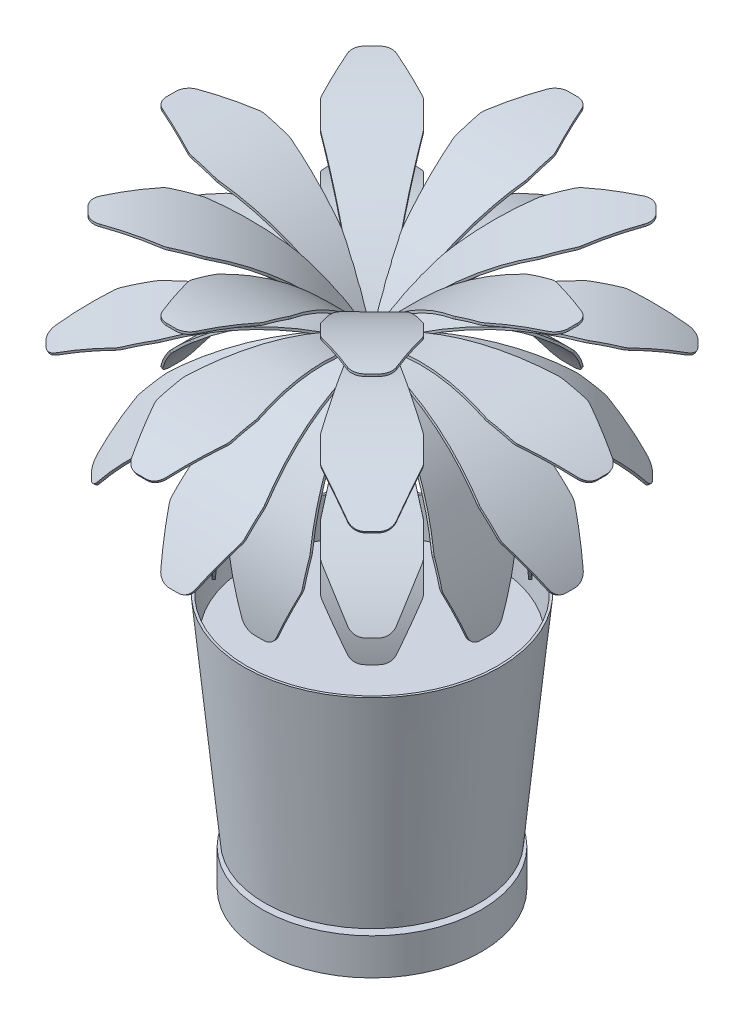
from build123d import *

# Parameters (mm, degrees)
SKETCH3_R           = 9.525
BOSS_EXTRUDE1_DEPTH = 177.8
BOSS_EXTRUDE1_TAPER = 2
BOSS_EXTRUDE2_DEPTH = 25.4
SKETCH5_OUTSIDE_W   = 263.022
SKETCH5_OUTSIDE_H   = 416.765
CUT_EXTRUDE1_DEPTH  = 355.580540036
FILLET6_R           = 9.525
CIRPATTERN2_COUNT   = 4
CIRPATTERN2_ANGLE   = 90
CIRPATTERN3_COUNT   = 8
SCALE2_SCALE        = 0.322033898


with BuildPart() as part:
    # Sketch1 → Revolve1 (revolve)
    with BuildSketch(Plane.XY, mode=Mode.PRIVATE) as revolve1_sk:
        Polygon((0, 0), (0, 152.4), (84.873325365, 152.4), (87.305240259, 177.8), (88.9, 177.8), (74.6125, 28.575), (69.85, 28.575), (69.85, 25.4), (76.2, 25.4), (76.2, 0), align=None)
    revolve(revolve1_sk.sketch.rotate(Axis((0, 0, 0), (0, -1, 0)), 180), axis=Axis((0, 0, 0), (0, -1, 0)))


with BuildPart() as body_2:
    # Sketch3 → Boss-Extrude1 (new body)
    with BuildSketch(Plane(origin=(0, 152.4, 0), x_dir=(1, 0, 0), z_dir=(0, 1, 0))):
        Circle(SKETCH3_R)
    extrude(amount=BOSS_EXTRUDE1_DEPTH, taper=BOSS_EXTRUDE1_TAPER)


with BuildPart() as body_3:
    # Sketch4 → Boss-Extrude2 (new, symmetric)
    with BuildSketch(Plane.XY):
        with BuildLine():
            Line((77.111818976, 190.5), (78.699318976, 190.5))
            ThreePointArc((78.699318976, 190.5), (57.943784129, 271.051748602), (0.846040202, 331.543269231))
            Line((0.846040202, 331.543269231), (0, 330.2))
            ThreePointArc((0, 330.2), (56.553955889, 270.284589091), (77.111818976, 190.5))
        make_face()
    extrude(amount=BOSS_EXTRUDE2_DEPTH, both=True)

    # Sketch5 outside → Cut-Extrude1 (cut, through all)
    with BuildSketch(Plane(origin=(0, 0, 0), x_dir=(0, 0, -1), z_dir=(1, 0, 0))):
        with Locations((0, 165.7715)):
            Rectangle(SKETCH5_OUTSIDE_W, SKETCH5_OUTSIDE_H)
        Polygon((-9.525, 190.5), (-25.4, 228.6), (-25.4, 247.65), (-6.35, 331.543269231), (6.35, 331.543269231), (25.4, 247.65), (25.4, 228.6), (9.525, 190.5), align=None, mode=Mode.SUBTRACT)
    extrude(amount=CUT_EXTRUDE1_DEPTH, mode=Mode.SUBTRACT)

    # Fillet6
    fillet6_edges = [body_3.edges().sort_by_distance(p)[0] for p in [
        (73.471074534, 228.6, 25.4),
        (67.750474889, 247.65, 25.4),
        (67.750474889, 247.65, -25.4),
        (73.471074534, 228.6, -25.4),
        (77.905568976, 190.5, 9.525),
        (77.905568976, 190.5, -9.525),
    ]]
    fillet(fillet6_edges, radius=FILLET6_R)


with BuildPart() as cirpattern2_1:
    # CirPattern2: pattern copy
    add(body_3.part.rotate(Axis((0, 330.2, 0), (0, 0, 1)), 1 * CIRPATTERN2_ANGLE / (CIRPATTERN2_COUNT - 1)))


with BuildPart() as cirpattern2_2:
    # CirPattern2: pattern copy
    add(body_3.part.rotate(Axis((0, 330.2, 0), (0, 0, 1)), 2 * CIRPATTERN2_ANGLE / (CIRPATTERN2_COUNT - 1)))


with BuildPart() as cirpattern2_3:
    # CirPattern2: pattern copy
    add(body_3.part.rotate(Axis((0, 330.2, 0), (0, 0, 1)), 3 * CIRPATTERN2_ANGLE / (CIRPATTERN2_COUNT - 1)))


with BuildPart() as cirpattern3_1:
    # CirPattern3: pattern copy
    add(cirpattern2_3.part.rotate(Axis((0, 0, 0), (0, 1, 0)), 1 * 360 / CIRPATTERN3_COUNT))


with BuildPart() as cirpattern3_2:
    # CirPattern3: pattern copy
    add(cirpattern2_3.part.rotate(Axis((0, 0, 0), (0, 1, 0)), 2 * 360 / CIRPATTERN3_COUNT))


with BuildPart() as cirpattern3_3:
    # CirPattern3: pattern copy
    add(cirpattern2_3.part.rotate(Axis((0, 0, 0), (0, 1, 0)), 3 * 360 / CIRPATTERN3_COUNT))


with BuildPart() as cirpattern3_4:
    # CirPattern3: pattern copy
    add(cirpattern2_3.part.rotate(Axis((0, 0, 0), (0, 1, 0)), 4 * 360 / CIRPATTERN3_COUNT))


with BuildPart() as cirpattern3_5:
    # CirPattern3: pattern copy
    add(cirpattern2_3.part.rotate(Axis((0, 0, 0), (0, 1, 0)), 5 * 360 / CIRPATTERN3_COUNT))


with BuildPart() as cirpattern3_6:
    # CirPattern3: pattern copy
    add(cirpattern2_3.part.rotate(Axis((0, 0, 0), (0, 1, 0)), 6 * 360 / CIRPATTERN3_COUNT))


with BuildPart() as cirpattern3_7:
    # CirPattern3: pattern copy
    add(cirpattern2_3.part.rotate(Axis((0, 0, 0), (0, 1, 0)), 7 * 360 / CIRPATTERN3_COUNT))


with BuildPart() as cirpattern3_8:
    # CirPattern3: pattern copy
    add(cirpattern2_2.part.rotate(Axis((0, 0, 0), (0, 1, 0)), 1 * 360 / CIRPATTERN3_COUNT))


with BuildPart() as cirpattern3_9:
    # CirPattern3: pattern copy
    add(cirpattern2_2.part.rotate(Axis((0, 0, 0), (0, 1, 0)), 2 * 360 / CIRPATTERN3_COUNT))


with BuildPart() as cirpattern3_10:
    # CirPattern3: pattern copy
    add(cirpattern2_2.part.rotate(Axis((0, 0, 0), (0, 1, 0)), 3 * 360 / CIRPATTERN3_COUNT))


with BuildPart() as cirpattern3_11:
    # CirPattern3: pattern copy
    add(cirpattern2_2.part.rotate(Axis((0, 0, 0), (0, 1, 0)), 4 * 360 / CIRPATTERN3_COUNT))


with BuildPart() as cirpattern3_12:
    # CirPattern3: pattern copy
    add(cirpattern2_2.part.rotate(Axis((0, 0, 0), (0, 1, 0)), 5 * 360 / CIRPATTERN3_COUNT))


with BuildPart() as cirpattern3_13:
    # CirPattern3: pattern copy
    add(cirpattern2_2.part.rotate(Axis((0, 0, 0), (0, 1, 0)), 6 * 360 / CIRPATTERN3_COUNT))


with BuildPart() as cirpattern3_14:
    # CirPattern3: pattern copy
    add(cirpattern2_2.part.rotate(Axis((0, 0, 0), (0, 1, 0)), 7 * 360 / CIRPATTERN3_COUNT))


with BuildPart() as cirpattern3_15:
    # CirPattern3: pattern copy
    add(cirpattern2_1.part.rotate(Axis((0, 0, 0), (0, 1, 0)), 1 * 360 / CIRPATTERN3_COUNT))


with BuildPart() as cirpattern3_16:
    # CirPattern3: pattern copy
    add(cirpattern2_1.part.rotate(Axis((0, 0, 0), (0, 1, 0)), 2 * 360 / CIRPATTERN3_COUNT))


with BuildPart() as cirpattern3_17:
    # CirPattern3: pattern copy
    add(cirpattern2_1.part.rotate(Axis((0, 0, 0), (0, 1, 0)), 3 * 360 / CIRPATTERN3_COUNT))


with BuildPart() as cirpattern3_18:
    # CirPattern3: pattern copy
    add(cirpattern2_1.part.rotate(Axis((0, 0, 0), (0, 1, 0)), 4 * 360 / CIRPATTERN3_COUNT))


with BuildPart() as cirpattern3_19:
    # CirPattern3: pattern copy
    add(cirpattern2_1.part.rotate(Axis((0, 0, 0), (0, 1, 0)), 5 * 360 / CIRPATTERN3_COUNT))


with BuildPart() as cirpattern3_20:
    # CirPattern3: pattern copy
    add(cirpattern2_1.part.rotate(Axis((0, 0, 0), (0, 1, 0)), 6 * 360 / CIRPATTERN3_COUNT))


with BuildPart() as cirpattern3_21:
    # CirPattern3: pattern copy
    add(cirpattern2_1.part.rotate(Axis((0, 0, 0), (0, 1, 0)), 7 * 360 / CIRPATTERN3_COUNT))


with BuildPart() as cirpattern3_22:
    # CirPattern3: pattern copy
    add(body_3.part.rotate(Axis((0, 0, 0), (0, 1, 0)), 1 * 360 / CIRPATTERN3_COUNT))


with BuildPart() as cirpattern3_23:
    # CirPattern3: pattern copy
    add(body_3.part.rotate(Axis((0, 0, 0), (0, 1, 0)), 2 * 360 / CIRPATTERN3_COUNT))


with BuildPart() as cirpattern3_24:
    # CirPattern3: pattern copy
    add(body_3.part.rotate(Axis((0, 0, 0), (0, 1, 0)), 3 * 360 / CIRPATTERN3_COUNT))


with BuildPart() as cirpattern3_25:
    # CirPattern3: pattern copy
    add(body_3.part.rotate(Axis((0, 0, 0), (0, 1, 0)), 4 * 360 / CIRPATTERN3_COUNT))


with BuildPart() as cirpattern3_26:
    # CirPattern3: pattern copy
    add(body_3.part.rotate(Axis((0, 0, 0), (0, 1, 0)), 5 * 360 / CIRPATTERN3_COUNT))


with BuildPart() as cirpattern3_27:
    # CirPattern3: pattern copy
    add(body_3.part.rotate(Axis((0, 0, 0), (0, 1, 0)), 6 * 360 / CIRPATTERN3_COUNT))


with BuildPart() as cirpattern3_28:
    # CirPattern3: pattern copy
    add(body_3.part.rotate(Axis((0, 0, 0), (0, 1, 0)), 7 * 360 / CIRPATTERN3_COUNT))


with BuildPart() as cirpattern3_9_1:
    # Scale2: scaled about (0, 0, 0)
    add(cirpattern3_9.part.scale(SCALE2_SCALE))


with BuildPart() as cirpattern3_28_1:
    # Scale2: scaled about (0, 0, 0)
    add(cirpattern3_28.part.scale(SCALE2_SCALE))


with BuildPart() as body_2_1:
    # Scale2: scaled about (0, 0, 0)
    add(body_2.part.scale(SCALE2_SCALE))


with BuildPart() as cirpattern3_3_1:
    # Scale2: scaled about (0, 0, 0)
    add(cirpattern3_3.part.scale(SCALE2_SCALE))


with BuildPart() as cirpattern3_8_1:
    # Scale2: scaled about (0, 0, 0)
    add(cirpattern3_8.part.scale(SCALE2_SCALE))


with BuildPart() as cirpattern3_27_1:
    # Scale2: scaled about (0, 0, 0)
    add(cirpattern3_27.part.scale(SCALE2_SCALE))


with BuildPart() as part_1:
    # Scale2: scaled about (0, 0, 0)
    add(part.part.scale(SCALE2_SCALE))


with BuildPart() as cirpattern3_2_1:
    # Scale2: scaled about (0, 0, 0)
    add(cirpattern3_2.part.scale(SCALE2_SCALE))


with BuildPart() as cirpattern3_26_1:
    # Scale2: scaled about (0, 0, 0)
    add(cirpattern3_26.part.scale(SCALE2_SCALE))


with BuildPart() as cirpattern3_21_1:
    # Scale2: scaled about (0, 0, 0)
    add(cirpattern3_21.part.scale(SCALE2_SCALE))


with BuildPart() as cirpattern3_25_1:
    # Scale2: scaled about (0, 0, 0)
    add(cirpattern3_25.part.scale(SCALE2_SCALE))


with BuildPart() as cirpattern3_1_1:
    # Scale2: scaled about (0, 0, 0)
    add(cirpattern3_1.part.scale(SCALE2_SCALE))


with BuildPart() as body_3_1:
    # Scale2: scaled about (0, 0, 0)
    add(body_3.part.scale(SCALE2_SCALE))


with BuildPart() as cirpattern3_20_1:
    # Scale2: scaled about (0, 0, 0)
    add(cirpattern3_20.part.scale(SCALE2_SCALE))


with BuildPart() as cirpattern3_24_1:
    # Scale2: scaled about (0, 0, 0)
    add(cirpattern3_24.part.scale(SCALE2_SCALE))


with BuildPart() as cirpattern2_1_1:
    # Scale2: scaled about (0, 0, 0)
    add(cirpattern2_1.part.scale(SCALE2_SCALE))


with BuildPart() as cirpattern3_14_1:
    # Scale2: scaled about (0, 0, 0)
    add(cirpattern3_14.part.scale(SCALE2_SCALE))


with BuildPart() as cirpattern3_19_1:
    # Scale2: scaled about (0, 0, 0)
    add(cirpattern3_19.part.scale(SCALE2_SCALE))


with BuildPart() as cirpattern3_23_1:
    # Scale2: scaled about (0, 0, 0)
    add(cirpattern3_23.part.scale(SCALE2_SCALE))


with BuildPart() as cirpattern2_2_1:
    # Scale2: scaled about (0, 0, 0)
    add(cirpattern2_2.part.scale(SCALE2_SCALE))


with BuildPart() as cirpattern3_13_1:
    # Scale2: scaled about (0, 0, 0)
    add(cirpattern3_13.part.scale(SCALE2_SCALE))


with BuildPart() as cirpattern3_18_1:
    # Scale2: scaled about (0, 0, 0)
    add(cirpattern3_18.part.scale(SCALE2_SCALE))


with BuildPart() as cirpattern3_22_1:
    # Scale2: scaled about (0, 0, 0)
    add(cirpattern3_22.part.scale(SCALE2_SCALE))


with BuildPart() as cirpattern2_3_1:
    # Scale2: scaled about (0, 0, 0)
    add(cirpattern2_3.part.scale(SCALE2_SCALE))


with BuildPart() as cirpattern3_7_1:
    # Scale2: scaled about (0, 0, 0)
    add(cirpattern3_7.part.scale(SCALE2_SCALE))


with BuildPart() as cirpattern3_12_1:
    # Scale2: scaled about (0, 0, 0)
    add(cirpattern3_12.part.scale(SCALE2_SCALE))


with BuildPart() as cirpattern3_17_1:
    # Scale2: scaled about (0, 0, 0)
    add(cirpattern3_17.part.scale(SCALE2_SCALE))


with BuildPart() as cirpattern3_6_1:
    # Scale2: scaled about (0, 0, 0)
    add(cirpattern3_6.part.scale(SCALE2_SCALE))


with BuildPart() as cirpattern3_11_1:
    # Scale2: scaled about (0, 0, 0)
    add(cirpattern3_11.part.scale(SCALE2_SCALE))


with BuildPart() as cirpattern3_16_1:
    # Scale2: scaled about (0, 0, 0)
    add(cirpattern3_16.part.scale(SCALE2_SCALE))


with BuildPart() as cirpattern3_5_1:
    # Scale2: scaled about (0, 0, 0)
    add(cirpattern3_5.part.scale(SCALE2_SCALE))


with BuildPart() as cirpattern3_10_1:
    # Scale2: scaled about (0, 0, 0)
    add(cirpattern3_10.part.scale(SCALE2_SCALE))


with BuildPart() as cirpattern3_15_1:
    # Scale2: scaled about (0, 0, 0)
    add(cirpattern3_15.part.scale(SCALE2_SCALE))


with BuildPart() as cirpattern3_4_1:
    # Scale2: scaled about (0, 0, 0)
    add(cirpattern3_4.part.scale(SCALE2_SCALE))


solid = Compound([cirpattern3_9_1.part, cirpattern3_28_1.part, body_2_1.part, cirpattern3_3_1.part, cirpattern3_8_1.part, cirpattern3_27_1.part, part_1.part, cirpattern3_2_1.part, cirpattern3_26_1.part, cirpattern3_21_1.part, cirpattern3_25_1.part, cirpattern3_1_1.part, body_3_1.part, cirpattern3_20_1.part, cirpattern3_24_1.part, cirpattern2_1_1.part, cirpattern3_14_1.part, cirpattern3_19_1.part, cirpattern3_23_1.part, cirpattern2_2_1.part, cirpattern3_13_1.part, cirpattern3_18_1.part, cirpattern3_22_1.part, cirpattern2_3_1.part, cirpattern3_7_1.part, cirpattern3_12_1.part, cirpattern3_17_1.part, cirpattern3_6_1.part, cirpattern3_11_1.part, cirpattern3_16_1.part, cirpattern3_5_1.part, cirpattern3_10_1.part, cirpattern3_15_1.part, cirpattern3_4_1.part])
